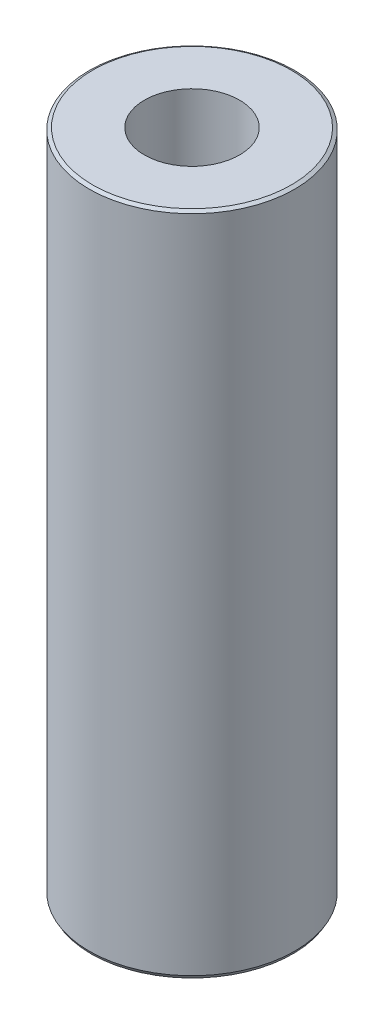
from build123d import *
from OCP.BRepFilletAPI import BRepFilletAPI_MakeChamfer

# Parameters (mm, degrees)
SKETCH1_R           = 27.5
BOSS_EXTRUDE1_DEPTH = 177.985862399
SKETCH2_R           = 12.725871691
CUT_EXTRUDE1_DEPTH  = 183.185255204
CHAMFER1_SIZE       = 0.524077938
CHAMFER1_SIZE2      = 0.907729616


with BuildPart() as part:
    # Sketch1 → Boss-Extrude1 (new body)
    with BuildSketch(Plane(origin=(0, 0, 0), x_dir=(1, 0, 0), z_dir=(0, 1, 0))):
        Circle(SKETCH1_R)
    extrude(amount=BOSS_EXTRUDE1_DEPTH)

    # Sketch2 → Cut-Extrude1 (cut, through all)
    with BuildSketch(Plane(origin=(0, 0, 0), x_dir=(1, 0, 0), z_dir=(0, 1, 0))):
        Circle(SKETCH2_R)
    extrude(amount=CUT_EXTRUDE1_DEPTH, mode=Mode.SUBTRACT)

    # Chamfer1: one chamfer whose edges measure the first distance from different faces: ONE call of the kernel's chamfer builder (chamfer() names one face for all edges)
    chamfer1_edges_1 = [part.edges().sort_by_distance(p)[0] for p in [
        (-27.5, 177.985862399, 0),
    ]]
    chamfer1_side_1 = [part.faces().sort_by_distance(p)[0] for p in [
        (-27.5, 88.992931199, 0),
    ]]
    chamfer1_edges_2 = [part.edges().sort_by_distance(p)[0] for p in [
        (-27.5, 0, 0),
    ]]
    chamfer1_side_2 = [part.faces().sort_by_distance(p)[0] for p in [
        (-26.722182541, 0, 0),
    ]]
    chamfer1 = BRepFilletAPI_MakeChamfer(part.part.solid().wrapped)
    for e in chamfer1_edges_1:
        chamfer1.Add(CHAMFER1_SIZE, CHAMFER1_SIZE2, e.wrapped, chamfer1_side_1[0].wrapped)  # the first distance lies on this face
    for e in chamfer1_edges_2:
        chamfer1.Add(CHAMFER1_SIZE, CHAMFER1_SIZE2, e.wrapped, chamfer1_side_2[0].wrapped)  # the first distance lies on this face
    add(Compound.cast(chamfer1.Shape()), mode=Mode.REPLACE)


solid = part.part
